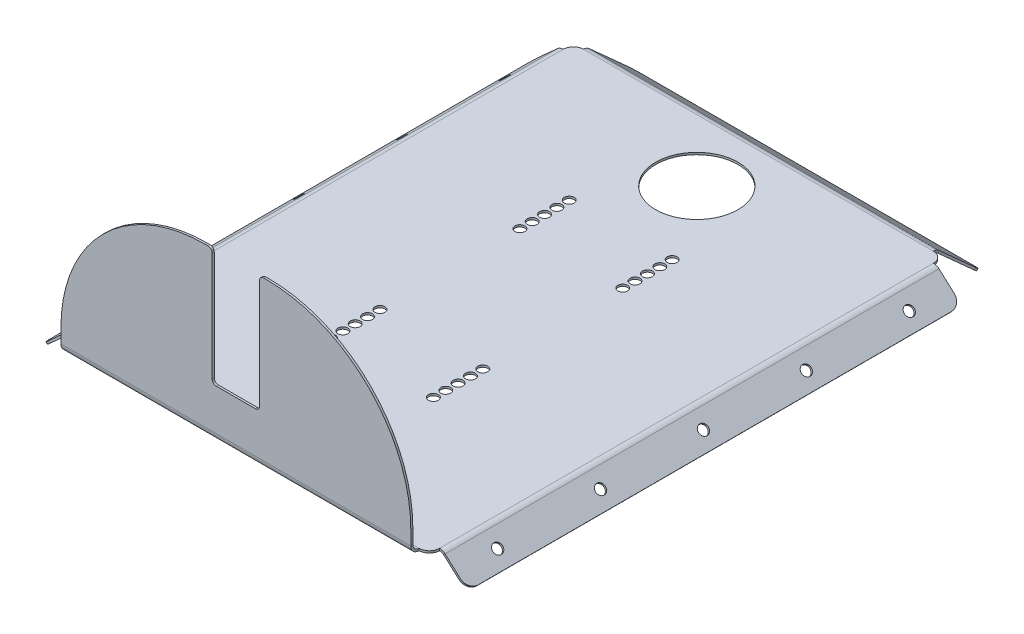
from build123d import *

# Parameters (mm, degrees)
ESBO_O1_W                 = 180
ESBO_O1_H                 = 250
FLANGE_BASE1_DEPTH        = 1
ESBO_O6_R                 = 2.4
ESBO_O6_R_2               = 20
CORTE_EXTRUS_O1_DEPTH     = 10
FILETE1_R                 = 5
ARESTA_FLANGE1_DEPTH      = 170
ARESTA_FLANGE2_DEPTH      = 240
ARESTA_FLANGE2_BEND_DEPTH = 240
FILETE2_R                 = 5
ARESTA_FLANGE3_DEPTH      = 170
FILETE3_R                 = 70
ESBO_O29_W                = 23
ESBO_O29_H                = 57
CORTE_EXTRUS_O2_DEPTH     = 308.427518565
FILETE4_R                 = 2
CORTE_EXTRUS_O3_REACH     = 220.213
ESBO_O32_R                = 2.4


# Sheet-metal steps are written as plain solids
with BuildPart() as part:
    # Esboço1 → Flange-base1 (new body)
    with BuildSketch(Plane(origin=(0, 0, 0), x_dir=(1, 0, 0), z_dir=(0, 1, 0))):
        Rectangle(ESBO_O1_W, ESBO_O1_H)
    extrude(amount=-FLANGE_BASE1_DEPTH)

    # Esboço6 → Corte-extrusão1 (cut)
    with BuildSketch(Plane(origin=(0, 0, 0), x_dir=(1, 0, 0), z_dir=(0, 1, 0))):
        with Locations(Location((-25, 52, 0), (0, 0, 270))):
            Circle(ESBO_O6_R)
        with Locations(Location((25, 52, 0), (0, 0, 270))):
            Circle(ESBO_O6_R)
        with Locations(Location((-25, -40, 0), (0, 0, 270))):
            Circle(ESBO_O6_R)
        with Locations(Location((25, -40, 0), (0, 0, 270))):
            Circle(ESBO_O6_R)
        with Locations(Location((-25, -46, 0), (0, 0, 270))):
            Circle(ESBO_O6_R)
        with Locations(Location((25, -46, 0), (0, 0, 270))):
            Circle(ESBO_O6_R)
        with Locations(Location((-25, 46, 0), (0, 0, 270))):
            Circle(ESBO_O6_R)
        with Locations(Location((25, 46, 0), (0, 0, 270))):
            Circle(ESBO_O6_R)
        with Locations(Location((-25, 58, 0), (0, 0, 270))):
            Circle(ESBO_O6_R)
        with Locations(Location((25, 58, 0), (0, 0, 270))):
            Circle(ESBO_O6_R)
        with Locations(Location((-25, -34, 0), (0, 0, 270))):
            Circle(ESBO_O6_R)
        with Locations(Location((25, -34, 0), (0, 0, 270))):
            Circle(ESBO_O6_R)
        with Locations(Location((-25, 40, 0), (0, 0, 270))):
            Circle(ESBO_O6_R)
        with Locations(Location((25, 40, 0), (0, 0, 270))):
            Circle(ESBO_O6_R)
        with Locations(Location((-25, -52, 0), (0, 0, 270))):
            Circle(ESBO_O6_R)
        with Locations(Location((25, -52, 0), (0, 0, 270))):
            Circle(ESBO_O6_R)
        with Locations(Location((-25, 34, 0), (0, 0, 270))):
            Circle(ESBO_O6_R)
        with Locations(Location((25, 34, 0), (0, 0, 270))):
            Circle(ESBO_O6_R)
        with Locations(Location((-25, -58, 0), (0, 0, 270))):
            Circle(ESBO_O6_R)
        with Locations(Location((25, -58, 0), (0, 0, 270))):
            Circle(ESBO_O6_R)
        with Locations(Location((0, 95, 0), (0, 0, 270))):
            Circle(ESBO_O6_R_2)
    extrude(amount=-CORTE_EXTRUS_O1_DEPTH, mode=Mode.SUBTRACT)

    # Filete1
    filete1_edges = [part.edges().sort_by_distance(p)[0] for p in [
        (90, -0.5, 125),
        (-90, -0.5, 125),
        (-90, -0.5, -125),
        (90, -0.5, -125),
    ]]
    fillet(filete1_edges, radius=FILETE1_R)

    # Aresta-Flange1 section (across the edge) → Aresta-Flange1 (add)
    with BuildSketch(Plane(origin=(-85, -1, -126.151592105), x_dir=(0, -0.7431448254773979, 0.6691306063588541), z_dir=(1, 0, 0))):
        with BuildLine():
            Line((-1, 1.151592105), (-1, 30))
            Line((-1, 30), (0, 30))
            Line((0, 30), (0, 1.151592105))
            ThreePointArc((0, 1.151592105), (0.199258721, 0.076488256), (0.770565524, -0.855799714))
            Line((0.770565524, -0.855799714), (0.027420698, -1.52493032))
            ThreePointArc((0.027420698, -1.52493032), (-0.734321706, -0.281879693), (-1, 1.151592105))
        make_face()
    extrude(amount=ARESTA_FLANGE1_DEPTH)

    # Aresta-Flange2 section (across the edge) → Aresta-Flange2 (add)
    with BuildSketch(Plane(origin=(91.151592105, -1, -120), x_dir=(-0.6691306063588541, -0.7431448254773979, 0), z_dir=(0, 0, 1))):
        with BuildLine():
            Line((-1, 1.151592105), (-1, 16.05))
            Line((-1, 16.05), (0, 16.05))
            Line((0, 16.05), (0, 1.151592105))
            ThreePointArc((0, 1.151592105), (0.199258721, 0.076488256), (0.770565524, -0.855799714))
            Line((0.770565524, -0.855799714), (0.027420698, -1.52493032))
            ThreePointArc((0.027420698, -1.52493032), (-0.734321706, -0.281879693), (-1, 1.151592105))
        make_face()
    extrude(amount=ARESTA_FLANGE2_DEPTH)

    # Aresta-Flange2 section 2 (across the edge) → Aresta-Flange2 bend (add)
    with BuildSketch(Plane(origin=(-91.151592105, -1, 120), x_dir=(0.6691306063588541, -0.7431448254773979, 0), z_dir=(0, 0, -1))):
        with BuildLine():
            Line((-1, 1.151592105), (-1, 16.05))
            Line((-1, 16.05), (0, 16.05))
            Line((0, 16.05), (0, 1.151592105))
            ThreePointArc((0, 1.151592105), (0.199258721, 0.076488256), (0.770565524, -0.855799714))
            Line((0.770565524, -0.855799714), (0.027420698, -1.52493032))
            ThreePointArc((0.027420698, -1.52493032), (-0.734321706, -0.281879693), (-1, 1.151592105))
        make_face()
    extrude(amount=ARESTA_FLANGE2_BEND_DEPTH)

    # Filete2
    filete2_edges = [part.edges().sort_by_distance(p)[0] for p in [
        (-85, -20.702345778, -148.780502173),
        (85, -20.702345778, -148.780502173),
        (103.413631857, -11.367973819, -120),
        (103.413631857, -11.367973819, 120),
        (-103.413631857, -11.367973819, 120),
        (-103.413631857, -11.367973819, -120),
    ]]
    fillet(filete2_edges, radius=FILETE2_R)

    # Aresta-Flange3 section (across the edge) → Aresta-Flange3 (add)
    with BuildSketch(Plane(origin=(-85, 0, 128), x_dir=(0, 0, -1), z_dir=(1, 0, 0))):
        with BuildLine():
            Line((-1, 3), (-1, 80))
            Line((-1, 80), (0, 80))
            Line((0, 80), (0, 3))
            ThreePointArc((0, 3), (0.878679656, 0.878679656), (3, 0))
            Line((3, 0), (3, -1))
            ThreePointArc((3, -1), (0.171572875, 0.171572875), (-1, 3))
        make_face()
    extrude(amount=ARESTA_FLANGE3_DEPTH)

    # Filete3
    filete3_edges = [part.edges().sort_by_distance(p)[0] for p in [
        (-85, 80, 128.5),
        (85, 80, 128.5),
    ]]
    fillet(filete3_edges, radius=FILETE3_R)

    # Esboço29 → Corte-extrusão2 (cut, through all)
    with BuildSketch(Plane.XY.offset(129)):
        with Locations((0, 51.5)):
            Rectangle(ESBO_O29_W, ESBO_O29_H)
    extrude(amount=-CORTE_EXTRUS_O2_DEPTH, mode=Mode.SUBTRACT)

    # Filete4
    filete4_edges = [part.edges().sort_by_distance(p)[0] for p in [
        (-11.5, 80, 128.5),
        (11.5, 80, 128.5),
        (11.5, 23, 128.5),
        (-11.5, 23, 128.5),
    ]]
    fillet(filete4_edges, radius=FILETE4_R)

    # Esboço32 → Corte-extrusão3 (cut, up to next)
    with BuildSketch(Plane(origin=(40.983697788, 45.517007667, 0), x_dir=(0.7431448254773984, -0.6691306063588536, 0), z_dir=(0.6691306063588536, 0.7431448254773984, 0)), mode=Mode.PRIVATE) as corte_extrus_o3_sk1:
        with Locations(Location((77.008760666, 0, 0), (0, 0, 180))):
            Circle(ESBO_O32_R)
    corte_extrus_o3_tool1 = extrude(corte_extrus_o3_sk1.sketch, amount=-CORTE_EXTRUS_O3_REACH, mode=Mode.PRIVATE) & part.part
    # Esboço32 → Corte-extrusão3 (cut, up to next)
    with BuildSketch(Plane(origin=(40.983697788, 45.517007667, 0), x_dir=(0.7431448254773984, -0.6691306063588536, 0), z_dir=(0.6691306063588536, 0.7431448254773984, 0)), mode=Mode.PRIVATE) as corte_extrus_o3_sk2:
        with Locations(Location((77.008760666, -100, 0), (0, 0, 180))):
            Circle(ESBO_O32_R)
    corte_extrus_o3_tool2 = extrude(corte_extrus_o3_sk2.sketch, amount=-CORTE_EXTRUS_O3_REACH, mode=Mode.PRIVATE) & part.part
    # Esboço32 → Corte-extrusão3 (cut, up to next)
    with BuildSketch(Plane(origin=(40.983697788, 45.517007667, 0), x_dir=(0.7431448254773984, -0.6691306063588536, 0), z_dir=(0.6691306063588536, 0.7431448254773984, 0)), mode=Mode.PRIVATE) as corte_extrus_o3_sk3:
        with Locations(Location((77.008760666, -50, 0), (0, 0, 180))):
            Circle(ESBO_O32_R)
    corte_extrus_o3_tool3 = extrude(corte_extrus_o3_sk3.sketch, amount=-CORTE_EXTRUS_O3_REACH, mode=Mode.PRIVATE) & part.part
    # Esboço32 → Corte-extrusão3 (cut, up to next)
    with BuildSketch(Plane(origin=(40.983697788, 45.517007667, 0), x_dir=(0.7431448254773984, -0.6691306063588536, 0), z_dir=(0.6691306063588536, 0.7431448254773984, 0)), mode=Mode.PRIVATE) as corte_extrus_o3_sk4:
        with Locations(Location((77.008760666, 50, 0), (0, 0, 180))):
            Circle(ESBO_O32_R)
    corte_extrus_o3_tool4 = extrude(corte_extrus_o3_sk4.sketch, amount=-CORTE_EXTRUS_O3_REACH, mode=Mode.PRIVATE) & part.part
    # Esboço32 → Corte-extrusão3 (cut, up to next)
    with BuildSketch(Plane(origin=(40.983697788, 45.517007667, 0), x_dir=(0.7431448254773984, -0.6691306063588536, 0), z_dir=(0.6691306063588536, 0.7431448254773984, 0)), mode=Mode.PRIVATE) as corte_extrus_o3_sk5:
        with Locations(Location((77.008760666, 100, 0), (0, 0, 180))):
            Circle(ESBO_O32_R)
    corte_extrus_o3_tool5 = extrude(corte_extrus_o3_sk5.sketch, amount=-CORTE_EXTRUS_O3_REACH, mode=Mode.PRIVATE) & part.part
    corte_extrus_o3_1 = corte_extrus_o3_tool1.solids().sort_by_distance((98.21236, -6.011911, 0))[0]
    add(corte_extrus_o3_1, mode=Mode.SUBTRACT)
    corte_extrus_o3_2 = corte_extrus_o3_tool2.solids().sort_by_distance((98.21236, -6.011911, 100))[0]
    add(corte_extrus_o3_2, mode=Mode.SUBTRACT)
    corte_extrus_o3_3 = corte_extrus_o3_tool3.solids().sort_by_distance((98.21236, -6.011911, 50))[0]
    add(corte_extrus_o3_3, mode=Mode.SUBTRACT)
    corte_extrus_o3_4 = corte_extrus_o3_tool4.solids().sort_by_distance((98.21236, -6.011911, -50))[0]
    add(corte_extrus_o3_4, mode=Mode.SUBTRACT)
    corte_extrus_o3_5 = corte_extrus_o3_tool5.solids().sort_by_distance((98.21236, -6.011911, -100))[0]
    add(corte_extrus_o3_5, mode=Mode.SUBTRACT)
    corte_extrus_o3 = corte_extrus_o3_1 + corte_extrus_o3_2 + corte_extrus_o3_3 + corte_extrus_o3_4 + corte_extrus_o3_5  # Corte-extrusão3 as one shape, for the pattern or mirror that repeats it

    # Espelhar1: Corte-extrusão3 across plane
    add(corte_extrus_o3.mirror(Plane(origin=(0, 0, 0), x_dir=(0, 0, 1), z_dir=(1, 0, 0))), mode=Mode.SUBTRACT)


solid = part.part
